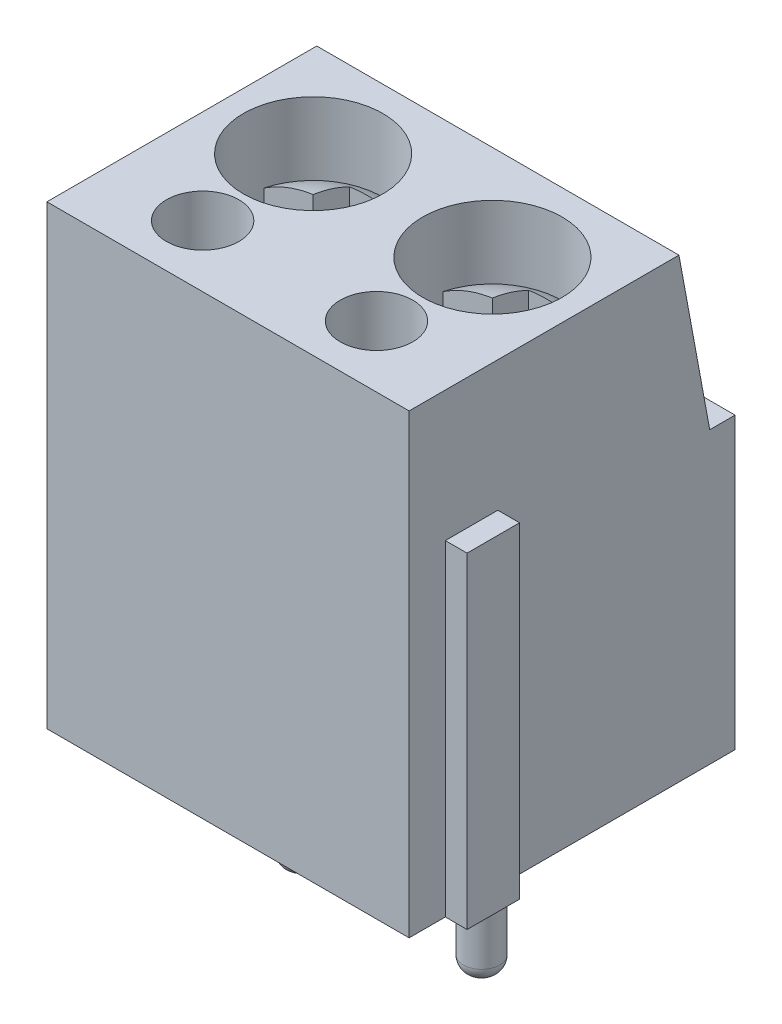
from build123d import *
from build123d.topology import SkipClean

# Parameters (mm, degrees)
BOSS_EXTRUDE1_DEPTH          = 10
SKETCH2_W                    = 4
SKETCH2_H                    = 6
CUT_EXTRUDE1_DEPTH           = 2
SKETCH3_W                    = 1
SKETCH3_H                    = 1
CUT_EXTRUDE2_DEPTH           = 5
SKETCH4_R                    = 1.5
CUT_EXTRUDE3_DEPTH           = 5
BOSS_EXTRUDE2_DEPTH          = 0.1
SKETCH7_R                    = 0.499
BOSS_EXTRUDE5_DEPTH          = 5.3
SKETCH8_W                    = 1.3
SKETCH8_H                    = 9
CUT_EXTRUDE4_DEPTH           = 0.6
SKETCH9_W                    = 1.45
SKETCH9_H                    = 9
BOSS_EXTRUDE6_DEPTH          = 0.6
SKETCH10_R                   = 1.925
SKETCH10_R_2                 = 1
CUT_EXTRUDE5_DEPTH           = 2
SKETCH11_W                   = 2
SKETCH11_H                   = 0.1
BOSS_EXTRUDE7_DEPTH          = 3
FILLET1_R                    = 0.1
FILLET2_R                    = 0.4
CUT_EXTRUDE6_DEPTH           = 3
SKETCH16_R                   = 1
CUT_EXTRUDE7_DEPTH           = 3
CUT_EXTRUDE8_DEPTH           = 1
CUT_EXTRUDE8_DRAFT           = -20
CUT_EXTRUDE8_PROFILE_2_DEPTH = 1
CUT_EXTRUDE8_PROFILE_2_DRAFT = -20


with BuildPart() as part:
    # Sketch1 → Boss-Extrude1 (new body)
    with BuildSketch(Plane(origin=(0, 0, 0), x_dir=(0, 0, -1), z_dir=(1, 0, 0))):
        Polygon((0, 0), (0, 12.6), (7.45, 12.6), (8.3, 8), (9, 8), (9, 0), align=None)
    extrude(amount=BOSS_EXTRUDE1_DEPTH)

    # Sketch2 → Cut-Extrude1 (cut)
    with BuildSketch(Plane(origin=(0, 0, -9), x_dir=(-1, 0, 0), z_dir=(0, 0, -1))):
        with Locations((-7.5, 4)):
            Rectangle(SKETCH2_W, SKETCH2_H)
        with Locations((-2.5, 4)):
            Rectangle(SKETCH2_W, SKETCH2_H)
    extrude(amount=-CUT_EXTRUDE1_DEPTH, mode=Mode.SUBTRACT)

    # Sketch3 → Cut-Extrude2 (cut)
    with BuildSketch(Plane(origin=(0, 0, -9), x_dir=(-1, 0, 0), z_dir=(0, 0, -1))):
        with Locations((-7.5, 0.5)):
            Rectangle(SKETCH3_W, SKETCH3_H)
        with Locations((-2.5, 0.5)):
            Rectangle(SKETCH3_W, SKETCH3_H)
    extrude(amount=-CUT_EXTRUDE2_DEPTH, mode=Mode.SUBTRACT)

    # Sketch4 → Cut-Extrude3 (cut)
    with BuildSketch(Plane(origin=(0, 0, -7), x_dir=(-1, 0, 0), z_dir=(0, 0, -1))):
        with Locations((-7.5, 3.5)):
            Circle(SKETCH4_R)
        with Locations((-2.5, 3.5)):
            Circle(SKETCH4_R)
    extrude(amount=-CUT_EXTRUDE3_DEPTH, mode=Mode.SUBTRACT)

    # Sketch6 → Boss-Extrude2 (add)
    with BuildSketch(Plane(origin=(0, 0, -7), x_dir=(-1, 0, 0), z_dir=(0, 0, -1))):
        Polygon((-9.5, 7), (-8.5, 4), (-6.5, 4), (-5.5, 7), align=None)
        Polygon((-4.5, 7), (-0.5, 7), (-1.5, 4), (-3.5, 4), align=None)
    extrude(amount=BOSS_EXTRUDE2_DEPTH)

    # Sketch7 → Boss-Extrude5 (add)
    with BuildSketch(Plane.XZ.offset(-1)):
        with Locations((2.5, -4.5)):
            Circle(SKETCH7_R)
        with Locations((7.5, -4.5)):
            Circle(SKETCH7_R)
    extrude(amount=BOSS_EXTRUDE5_DEPTH)

    # Sketch8 → Cut-Extrude4 (cut)
    with BuildSketch(Plane.ZY):
        with Locations((-1.65, 4.5)):
            Rectangle(SKETCH8_W, SKETCH8_H)
    extrude(amount=-CUT_EXTRUDE4_DEPTH, mode=Mode.SUBTRACT)

    # Sketch9 → Boss-Extrude6 (add)
    with BuildSketch(Plane(origin=(10, 0, 0), x_dir=(0, 0, -1), z_dir=(1, 0, 0))):
        with Locations((1.725, 4.5)):
            Rectangle(SKETCH9_W, SKETCH9_H)
    extrude(amount=BOSS_EXTRUDE6_DEPTH)

    # Sketch10 → Cut-Extrude5 (cut)
    with BuildSketch(Plane(origin=(0, 12.6, 0), x_dir=(1, 0, 0), z_dir=(0, 1, 0))):
        with Locations((2.525, 4.825)):
            Circle(SKETCH10_R)
        with Locations((7.4, 1.7)):
            Circle(SKETCH10_R_2)
        with Locations((2.6, 1.7)):
            Circle(SKETCH10_R_2)
        with Locations((7.475, 4.825)):
            Circle(SKETCH10_R)
    extrude(amount=-CUT_EXTRUDE5_DEPTH, mode=Mode.SUBTRACT)

    # Sketch11 → Boss-Extrude7 (add)
    with BuildSketch(Plane(origin=(0, 0, -7.1), x_dir=(-1, 0, 0), z_dir=(0, 0, -1))):
        with Locations((-7.5, 3.95)):
            Rectangle(SKETCH11_W, SKETCH11_H)
        with Locations((-2.5, 3.95)):
            Rectangle(SKETCH11_W, SKETCH11_H)
    extrude(amount=-BOSS_EXTRUDE7_DEPTH)

    # Fillet1
    fillet1_edges = [part.edges().sort_by_distance(p)[0] for p in [
        (2.5, 3.9, -7.1),
        (7.5, 3.9, -7.1),
    ]]
    fillet(fillet1_edges, radius=FILLET1_R)

    # Fillet2
    fillet2_edges = [part.edges().sort_by_distance(p)[0] for p in [
        (7.001, -4.3, -4.5),
        (2.001, -4.3, -4.5),
    ]]
    fillet(fillet2_edges, radius=FILLET2_R)

    # Sketch13 → Revolve1 (revolve)
    with BuildSketch(Plane.XY.offset(-4.825)):
        with BuildLine():
            Line((7.475, 11.197885372), (7.475, 10.6))
            Line((7.475, 10.6), (9.4, 10.6))
            ThreePointArc((9.4, 10.6), (8.482855634, 11.044973347), (7.475, 11.197885372))
        make_face()
    revolve1 = revolve(axis=Axis((7.475, 10.6, -4.825), (0, 1, 0)))

    # Sketch15 → Cut-Extrude6 (cut)
    with BuildSketch(Plane(origin=(0, 12.6, 0), x_dir=(1, 0, 0), z_dir=(0, 1, 0))):
        with BuildLine():
            Line((7.975, 6.325), (6.975, 6.325))
            Line((6.975, 6.325), (6.975, 5.325))
            Line((6.975, 5.325), (5.616068855, 5.325))
            ThreePointArc((5.616068855, 5.325), (5.55, 4.825), (5.616068855, 4.325))
            Line((5.616068855, 4.325), (6.975, 4.325))
            Line((6.975, 4.325), (6.975, 3.325))
            Line((6.975, 3.325), (7.975, 3.325))
            Line((7.975, 3.325), (7.975, 4.325))
            Line((7.975, 4.325), (9.333931145, 4.325))
            ThreePointArc((9.333931145, 4.325), (9.4, 4.825), (9.333931145, 5.325))
            Line((9.333931145, 5.325), (7.975, 5.325))
            Line((7.975, 5.325), (7.975, 6.325))
        make_face()
    cut_extrude6 = extrude(amount=-CUT_EXTRUDE6_DEPTH, mode=Mode.SUBTRACT)

    # Mirror1: Revolve1, Cut-Extrude6 across plane
    with SkipClean():  # the faces are left unmerged after this step: merging them gives an invalid solid
        add(revolve1.mirror(Plane(origin=(5, 0, 0), x_dir=(0, 0, 1), z_dir=(1, 0, 0))))
        add(cut_extrude6.mirror(Plane(origin=(5, 0, 0), x_dir=(0, 0, 1), z_dir=(1, 0, 0))), mode=Mode.SUBTRACT)

    # Sketch16 → Cut-Extrude7 (cut)
    with SkipClean():  # the faces are left unmerged after this step: merging them gives an invalid solid
        with BuildSketch(Plane(origin=(0, 10.6, 0), x_dir=(1, 0, 0), z_dir=(0, 1, 0))):
            with Locations((2.6, 1.7)):
                Circle(SKETCH16_R)
            with Locations((7.4, 1.7)):
                Circle(SKETCH16_R)
        extrude(amount=-CUT_EXTRUDE7_DEPTH, mode=Mode.SUBTRACT)


with BuildPart() as cut_extrude8_tool:
    # Sketch17 → Cut-Extrude8 (with draft: the straight prism first)
    with BuildSketch(Plane(origin=(0, 9.6, 0), x_dir=(1, 0, 0), z_dir=(0, 1, 0))):
        with BuildLine():
            Line((2.025, 5.325), (0.666068855, 5.325))
            ThreePointArc((0.666068855, 5.325), (0.6, 4.825), (0.666068855, 4.325))
            Line((0.666068855, 4.325), (2.025, 4.325))
            Line((2.025, 4.325), (2.025, 3.325))
            Line((2.025, 3.325), (3.025, 3.325))
            Line((3.025, 3.325), (3.025, 4.325))
            Line((3.025, 4.325), (4.383931145, 4.325))
            ThreePointArc((4.383931145, 4.325), (4.45, 4.825), (4.383931145, 5.325))
            Line((4.383931145, 5.325), (3.025, 5.325))
            Line((3.025, 5.325), (3.025, 6.325))
            Line((3.025, 6.325), (2.025, 6.325))
            Line((2.025, 6.325), (2.025, 5.325))
        make_face()
    extrude(amount=-CUT_EXTRUDE8_DEPTH)
    # Cut-Extrude8: the draft: its side faces are tilted about the plane it starts from
    cut_extrude8_sides = [cut_extrude8_tool.faces().sort_by_distance(p)[0] for p in [
        (1.345534428, 9.1, -5.325),
        (0.6, 9.1, -4.825),
        (1.345534428, 9.1, -4.325),
        (2.025, 9.1, -3.825),
        (2.525, 9.1, -3.325),
        (3.025, 9.1, -3.825),
        (3.704465572, 9.1, -4.325),
        (4.45, 9.1, -4.825),
        (3.704465572, 9.1, -5.325),
        (3.025, 9.1, -5.825),
        (2.525, 9.1, -6.325),
        (2.025, 9.1, -5.825),
    ]]
    draft(cut_extrude8_sides, Plane(origin=(0, 9.6, 0), x_dir=(1, 0, 0), z_dir=(0, 1, 0)), CUT_EXTRUDE8_DRAFT)


with BuildPart() as part_1:
    add(part.part)

    # Cut-Extrude8: cut by cut_extrude8_tool
    add(cut_extrude8_tool.part, mode=Mode.SUBTRACT)


with BuildPart() as cut_extrude8_profile_2_tool:
    # Sketch17 → Cut-Extrude8 profile 2 (with draft: the straight prism first)
    with BuildSketch(Plane(origin=(0, 9.6, 0), x_dir=(1, 0, 0), z_dir=(0, 1, 0))):
        with BuildLine():
            Line((9.333931145, 5.325), (7.975, 5.325))
            Line((7.975, 5.325), (7.975, 6.325))
            Line((7.975, 6.325), (6.975, 6.325))
            Line((6.975, 6.325), (6.975, 5.325))
            Line((6.975, 5.325), (5.616068855, 5.325))
            ThreePointArc((5.616068855, 5.325), (5.55, 4.825), (5.616068855, 4.325))
            Line((5.616068855, 4.325), (6.975, 4.325))
            Line((6.975, 4.325), (6.975, 3.325))
            Line((6.975, 3.325), (7.975, 3.325))
            Line((7.975, 3.325), (7.975, 4.325))
            Line((7.975, 4.325), (9.333931145, 4.325))
            ThreePointArc((9.333931145, 4.325), (9.4, 4.825), (9.333931145, 5.325))
        make_face()
    extrude(amount=-CUT_EXTRUDE8_PROFILE_2_DEPTH)
    # Cut-Extrude8 profile 2: the draft: its side faces are tilted about the plane it starts from
    cut_extrude8_profile_2_sides = [cut_extrude8_profile_2_tool.faces().sort_by_distance(p)[0] for p in [
        (8.654465572, 9.1, -5.325),
        (7.975, 9.1, -5.825),
        (7.475, 9.1, -6.325),
        (6.975, 9.1, -5.825),
        (6.295534428, 9.1, -5.325),
        (5.55, 9.1, -4.825),
        (6.295534428, 9.1, -4.325),
        (6.975, 9.1, -3.825),
        (7.475, 9.1, -3.325),
        (7.975, 9.1, -3.825),
        (8.654465572, 9.1, -4.325),
        (9.4, 9.1, -4.825),
    ]]
    draft(cut_extrude8_profile_2_sides, Plane(origin=(0, 9.6, 0), x_dir=(1, 0, 0), z_dir=(0, 1, 0)), CUT_EXTRUDE8_PROFILE_2_DRAFT)


with BuildPart() as part_2:
    add(part_1.part)

    # Cut-Extrude8 profile 2: cut by cut_extrude8_profile_2_tool
    add(cut_extrude8_profile_2_tool.part, mode=Mode.SUBTRACT)


solid = part_2.part
